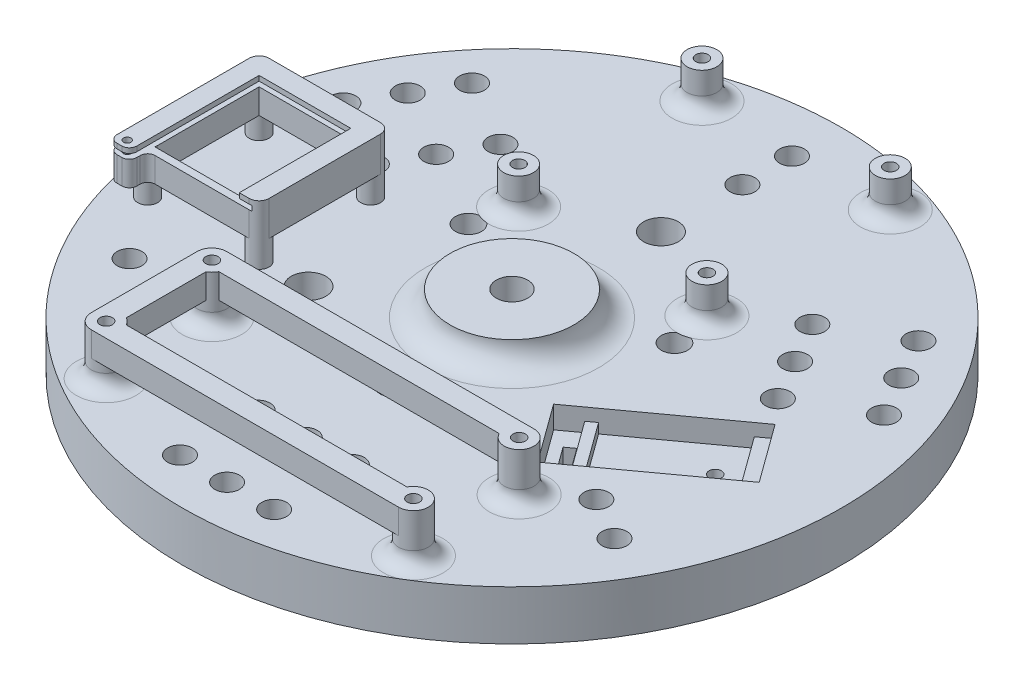
from build123d import *

# Parameters (mm, degrees)
BOSS_EXTRUDE7_DEPTH  = 10
SKETCH1_23_R         = 65.000000017
SKETCH1_23_R_2       = 4.125
BOSS_EXTRUDE8_DEPTH  = 10
CUT_EXTRUDE1_START   = 65
SKETCH16_R           = 2.5
CUT_EXTRUDE1_DEPTH   = 20
BOSS_EXTRUDE9_START  = -0.5
SKETCH17_R           = 12.5
SKETCH17_R_2         = 3.175
BOSS_EXTRUDE9_DEPTH  = 5.5
FILLET1_R            = 5
SKETCH18_R           = 2.5
SKETCH18_R_2         = 3.5
CUT_EXTRUDE2_DEPTH   = 10
SKETCH19_R           = 3
SKETCH19_R_2         = 1.25
BOSS_EXTRUDE10_DEPTH = 7.5
FILLET2_R            = 3
SKETCH20_R           = 2.625
CUT_EXTRUDE11_DEPTH  = 25
CUT_EXTRUDE12_DEPTH  = 9.8
SKETCH19_10_R        = 1.25
CUT_EXTRUDE13_DEPTH  = 4.5
CUT_EXTRUDE14_DEPTH  = 2.5
SKETCH19_12_R        = 1.25
CUT_EXTRUDE15_DEPTH  = 12.5
BOSS_EXTRUDE22_START = 5
SKETCH19_13_R        = 1.25
BOSS_EXTRUDE22_DEPTH = 5
SKETCH19_14_R        = 2
BOSS_EXTRUDE23_DEPTH = 7.5
BOSS_EXTRUDE24_START = 5
BOSS_EXTRUDE24_DEPTH = 5
BOSS_EXTRUDE25_START = 10
BOSS_EXTRUDE25_DEPTH = 1
BOSS_EXTRUDE26_START = 11
BOSS_EXTRUDE26_DEPTH = 1
BOSS_EXTRUDE27_START = -1
SKETCH23_R           = 0.75
BOSS_EXTRUDE27_DEPTH = 1
BOSS_EXTRUDE28_START = -7
SKETCH23_3_R         = 0.75
BOSS_EXTRUDE28_DEPTH = 5
FILLET15_R           = 1.5
FILLET16_R           = 1.5


with BuildPart() as part:
    # Sketch1 → Boss-Extrude7 (new body)
    with BuildSketch(Plane(origin=(0, 0, 0), x_dir=(1, 0, 0), z_dir=(0, 1, 0))):
        with BuildLine():
            ThreePointArc((-10.099280768, -64.210626285), (-56.291651246, -32.5), (-60.65767394, 23.359079438))
            Line((-60.65767394, 23.359079438), (-64.257390064, 17.124188218))
            ThreePointArc((-64.257390064, 17.124188218), (-57.590689352, -33.25), (-17.298713017, -64.210626285))
            Line((-17.298713017, -64.210626285), (-10.099280768, -64.210626285))
        make_face()
        with BuildLine():
            Line((-64.257390064, 17.124188218), (-60.65767394, 23.359079438))
            ThreePointArc((-60.65767394, 23.359079438), (-60.639599413, 23.405960416), (-60.621488653, 23.452827409))
            Line((-60.621488653, 23.452827409), (-61.93581913, 24.211656463))
            ThreePointArc((-61.93581913, 24.211656463), (-63.196040724, 20.700493636), (-64.257390064, 17.124188218))
        make_face()
        with BuildLine():
            ThreePointArc((-60.621488653, 23.452827409), (-59.667920988, 25.782536821), (-58.624860802, 28.073576473))
            ThreePointArc((-58.624860802, 28.073576473), (-54.991019149, 34.65527107), (-50.621488653, 40.773335485))
            Line((-50.621488653, 40.773335485), (-51.93581913, 41.532164539))
            ThreePointArc((-51.93581913, 41.532164539), (-57.590689352, 33.25), (-61.93581913, 24.211656463))
            Line((-61.93581913, 24.211656463), (-60.621488653, 23.452827409))
        make_face()
        with BuildLine():
            ThreePointArc((-50.621488653, 40.773335485), (-50.589956027, 40.812453359), (-50.558393172, 40.851546848))
            Line((-50.558393172, 40.851546848), (-46.958677048, 47.086438068))
            ThreePointArc((-46.958677048, 47.086438068), (-49.525173722, 44.379129868), (-51.93581913, 41.532164539))
            Line((-51.93581913, 41.532164539), (-50.621488653, 40.773335485))
        make_face()
        with BuildLine():
            Line((-46.958677048, 47.086438068), (-50.558393172, 40.851546848))
            ThreePointArc((-50.558393172, 40.851546848), (0, 65), (50.558393172, 40.851546848))
            Line((50.558393172, 40.851546848), (46.958677048, 47.086438068))
            ThreePointArc((46.958677048, 47.086438068), (0, 66.5), (-46.958677048, 47.086438068))
        make_face()
        with BuildLine():
            Line((46.958677048, 47.086438068), (50.558393172, 40.851546848))
            ThreePointArc((50.558393172, 40.851546848), (50.589956027, 40.812453359), (50.621488653, 40.773335485))
            Line((50.621488653, 40.773335485), (51.93581913, 41.532164539))
            ThreePointArc((51.93581913, 41.532164539), (49.525173722, 44.379129868), (46.958677048, 47.086438068))
        make_face()
        with BuildLine():
            Line((51.93581913, 41.532164539), (50.621488653, 40.773335485))
            ThreePointArc((50.621488653, 40.773335485), (52.162292355, 38.782666956), (53.624860802, 36.733830511))
            ThreePointArc((53.624860802, 36.733830511), (57.507854696, 30.295984028), (60.621488653, 23.452827409))
            Line((60.621488653, 23.452827409), (61.93581913, 24.211656463))
            ThreePointArc((61.93581913, 24.211656463), (57.590689352, 33.25), (51.93581913, 41.532164539))
        make_face()
        with BuildLine():
            ThreePointArc((64.257390064, 17.124188218), (63.196040724, 20.700493636), (61.93581913, 24.211656463))
            Line((61.93581913, 24.211656463), (60.621488653, 23.452827409))
            ThreePointArc((60.621488653, 23.452827409), (60.639599413, 23.405960416), (60.65767394, 23.359079438))
            Line((60.65767394, 23.359079438), (64.257390064, 17.124188218))
        make_face()
        with BuildLine():
            ThreePointArc((66.5, 0), (65.936963986, 8.635205867), (64.257390064, 17.124188218))
            Line((64.257390064, 17.124188218), (60.65767394, 23.359079438))
            ThreePointArc((60.65767394, 23.359079438), (63.90519856, 11.879629495), (65, 0))
            ThreePointArc((65, 0), (49.40371064, -42.240660211), (10.099280768, -64.210626285))
            Line((10.099280768, -64.210626285), (17.298713017, -64.210626285))
            ThreePointArc((17.298713017, -64.210626285), (52.785482927, -40.44678964), (66.5, 0))
        make_face()
        with BuildLine():
            ThreePointArc((-10, -64.226162893), (-10.049643386, -64.218413775), (-10.099280768, -64.210626285))
            Line((-10.099280768, -64.210626285), (-17.298713017, -64.210626285))
            ThreePointArc((-17.298713017, -64.210626285), (-13.670867002, -65.079623504), (-10, -65.743821002))
            Line((-10, -65.743821002), (-10, -64.226162893))
        make_face()
        with BuildLine():
            ThreePointArc((5, -64.807406984), (-2.516835548, -64.951255098), (-10, -64.226162893))
            Line((-10, -64.226162893), (-10, -65.743821002))
            ThreePointArc((-10, -65.743821002), (0, -66.5), (10, -65.743821002))
            Line((10, -65.743821002), (10, -64.226162893))
            ThreePointArc((10, -64.226162893), (7.505628633, -64.565203777), (5, -64.807406984))
        make_face()
        with BuildLine():
            Line((10, -64.226162893), (10, -65.743821002))
            ThreePointArc((10, -65.743821002), (13.670867002, -65.079623504), (17.298713017, -64.210626285))
            Line((17.298713017, -64.210626285), (10.099280768, -64.210626285))
            ThreePointArc((10.099280768, -64.210626285), (10.049643386, -64.218413775), (10, -64.226162893))
        make_face()
    extrude(amount=BOSS_EXTRUDE7_DEPTH)

    # Sketch1<23> → Boss-Extrude8 (add)
    with BuildSketch(Plane(origin=(0, 0, 0), x_dir=(1, 0, 0), z_dir=(0, 1, 0))):
        with Locations((-3e-09, 1.7e-08)):
            Circle(SKETCH1_23_R)
        with Locations(Location((0, 0, 0), (0, 0, 270))):
            Circle(SKETCH1_23_R_2, mode=Mode.SUBTRACT)
    extrude(amount=BOSS_EXTRUDE8_DEPTH)

    # Sketch16 → Cut-Extrude1 (cut)
    with BuildSketch(Plane.XZ.offset(-75).offset(CUT_EXTRUDE1_START)):
        with Locations(Location((36.217182386, -20.91, 0), (0, 0, 90))):
            Circle(SKETCH16_R)
        with Locations(Location((49.796460718, -28.75, 0), (0, 0, 90))):
            Circle(SKETCH16_R)
        with Locations(Location((-40.967182386, -12.682758664, 0), (0, 0, 90))):
            Circle(SKETCH16_R)
        with Locations(Location((-36.217182386, -20.91, 0), (0, 0, 90))):
            Circle(SKETCH16_R)
        with Locations(Location((-49.796460718, -28.75, 0), (0, 0, 90))):
            Circle(SKETCH16_R)
        with Locations(Location((0, 41.82, 0), (0, 0, 90))):
            Circle(SKETCH16_R)
        with Locations(Location((0, 57.5, 0), (0, 0, 90))):
            Circle(SKETCH16_R)
        with Locations(Location((-31.467182386, -29.137241336, 0), (0, 0, 90))):
            Circle(SKETCH16_R)
        with Locations(Location((-45.046460718, -36.977241336, 0), (0, 0, 90))):
            Circle(SKETCH16_R)
        with Locations(Location((-54.546460718, -20.522758664, 0), (0, 0, 90))):
            Circle(SKETCH16_R)
        with Locations(Location((9.5, 41.82, 0), (0, 0, 90))):
            Circle(SKETCH16_R)
        with Locations(Location((-9.5, 41.82, 0), (0, 0, 90))):
            Circle(SKETCH16_R)
        with Locations(Location((-9.5, 57.5, 0), (0, 0, 90))):
            Circle(SKETCH16_R)
        with Locations(Location((9.5, 57.5, 0), (0, 0, 90))):
            Circle(SKETCH16_R)
        with Locations(Location((31.467182386, -29.137241336, 0), (0, 0, 90))):
            Circle(SKETCH16_R)
        with Locations(Location((40.967182386, -12.682758664, 0), (0, 0, 90))):
            Circle(SKETCH16_R)
        with Locations(Location((54.546460718, -20.522758664, 0), (0, 0, 90))):
            Circle(SKETCH16_R)
        with Locations(Location((45.046460718, -36.977241336, 0), (0, 0, 90))):
            Circle(SKETCH16_R)
    extrude(amount=CUT_EXTRUDE1_DEPTH, mode=Mode.SUBTRACT)

    # Sketch17 → Boss-Extrude9 (add)
    with BuildSketch(Plane(origin=(0, 10, 0), x_dir=(1, 0, 0), z_dir=(0, 1, 0)).offset(BOSS_EXTRUDE9_START)):
        with Locations(Location((0, 0, 0), (0, 0, 270))):
            Circle(SKETCH17_R)
        with Locations(Location((0, 0, 0), (0, 0, 270))):
            Circle(SKETCH17_R_2, mode=Mode.SUBTRACT)
    extrude(amount=BOSS_EXTRUDE9_DEPTH)

    # Fillet1
    fillet1_edges = [part.edges().sort_by_distance(p)[0] for p in [
        (0, 10, -12.5),
    ]]
    fillet(fillet1_edges, radius=FILLET1_R - 0.0001)  # a hair under: the kernel refuses the full size

    # Sketch18 → Cut-Extrude2 (cut)
    with BuildSketch(Plane(origin=(0, 10, 0), x_dir=(1, 0, 0), z_dir=(0, 1, 0))):
        with Locations(Location((0, 56.5, 0), (0, 0, 270))):
            Circle(SKETCH18_R)
        with Locations(Location((0, 46.5, 0), (0, 0, 270))):
            Circle(SKETCH18_R)
        with Locations(Location((40.270181276, -23.25, 0), (0, 0, 270))):
            Circle(SKETCH18_R)
        with Locations(Location((48.930435314, -28.25, 0), (0, 0, 270))):
            Circle(SKETCH18_R)
        with Locations(Location((-40.270181276, -23.25, 0), (0, 0, 270))):
            Circle(SKETCH18_R)
        with Locations(Location((-48.930435314, -28.25, 0), (0, 0, 270))):
            Circle(SKETCH18_R)
        with Locations(Location((-26.035163591, -15.031408708, 0), (0, 0, 270))):
            Circle(SKETCH18_R_2)
        with Locations(Location((0, 30.062817415, 0), (0, 0, 270))):
            Circle(SKETCH18_R_2)
    extrude(amount=-CUT_EXTRUDE2_DEPTH, mode=Mode.SUBTRACT)

    # Sketch19 → Boss-Extrude10 (add)
    # profile 1 of 8: a face of its own
    with BuildSketch(Plane(origin=(0, 10, 0), x_dir=(1, 0, 0), z_dir=(0, 1, 0))):
        with Locations(Location((31.651031793, -30.207147099, 0), (0, 0, 270))):
            Circle(SKETCH19_R)
        with Locations(Location((31.651031793, -30.207147099, 0), (0, 0, 270))):
            Circle(SKETCH19_R_2, mode=Mode.SUBTRACT)
    # profile 2 of 8: a face of its own
    with BuildSketch(Plane(origin=(0, 10, 0), x_dir=(1, 0, 0), z_dir=(0, 1, 0))):
        with Locations(Location((31.651031793, -51.547147099, 0), (0, 0, 270))):
            Circle(SKETCH19_R)
        with Locations(Location((31.651031793, -51.547147099, 0), (0, 0, 270))):
            Circle(SKETCH19_R_2, mode=Mode.SUBTRACT)
    # profile 3 of 8: a face of its own
    with BuildSketch(Plane(origin=(0, 10, 0), x_dir=(1, 0, 0), z_dir=(0, 1, 0))):
        with Locations(Location((-30.348968207, -51.547147099, 0), (0, 0, 270))):
            Circle(SKETCH19_R)
        with Locations(Location((-30.348968207, -51.547147099, 0), (0, 0, 270))):
            Circle(SKETCH19_R_2, mode=Mode.SUBTRACT)
    # profile 4 of 8: a face of its own
    with BuildSketch(Plane(origin=(0, 10, 0), x_dir=(1, 0, 0), z_dir=(0, 1, 0))):
        with Locations(Location((-30.348968207, -30.207147099, 0), (0, 0, 270))):
            Circle(SKETCH19_R)
        with Locations(Location((-30.348968207, -30.207147099, 0), (0, 0, 270))):
            Circle(SKETCH19_R_2, mode=Mode.SUBTRACT)
    # profile 5 of 8: a face of its own
    with BuildSketch(Plane(origin=(0, 10, 0), x_dir=(1, 0, 0), z_dir=(0, 1, 0))):
        with Locations(Location((19.296192499, 57.037679725, 0), (0, 0, 270))):
            Circle(SKETCH19_R)
        with Locations(Location((19.296192499, 57.037679725, 0), (0, 0, 270))):
            Circle(SKETCH19_R_2, mode=Mode.SUBTRACT)
    # profile 6 of 8: a face of its own
    with BuildSketch(Plane(origin=(0, 10, 0), x_dir=(1, 0, 0), z_dir=(0, 1, 0))):
        with Locations(Location((19.296192499, 20.037679725, 0), (0, 0, 270))):
            Circle(SKETCH19_R)
        with Locations(Location((19.296192499, 20.037679725, 0), (0, 0, 270))):
            Circle(SKETCH19_R_2, mode=Mode.SUBTRACT)
    # profile 7 of 8: a face of its own
    with BuildSketch(Plane(origin=(0, 10, 0), x_dir=(1, 0, 0), z_dir=(0, 1, 0))):
        with Locations(Location((-18.703807501, 20.037679725, 0), (0, 0, 270))):
            Circle(SKETCH19_R)
        with Locations(Location((-18.703807501, 20.037679725, 0), (0, 0, 270))):
            Circle(SKETCH19_R_2, mode=Mode.SUBTRACT)
    # profile 8 of 8: a face of its own
    with BuildSketch(Plane(origin=(0, 10, 0), x_dir=(1, 0, 0), z_dir=(0, 1, 0))):
        with Locations(Location((-18.703807501, 57.037679725, 0), (0, 0, 270))):
            Circle(SKETCH19_R)
        with Locations(Location((-18.703807501, 57.037679725, 0), (0, 0, 270))):
            Circle(SKETCH19_R_2, mode=Mode.SUBTRACT)
    extrude(amount=BOSS_EXTRUDE10_DEPTH)

    # Fillet2
    fillet2_edges = [part.edges().sort_by_distance(p)[0] for p in [
        (-18.703807501, 10, -60.037679725),
        (-18.703807501, 10, -23.037679725),
        (19.296192499, 10, -23.037679725),
        (19.296192499, 10, -60.037679725),
        (-30.348968207, 10, 27.207147099),
        (-30.348968207, 10, 48.547147099),
        (31.651031793, 10, 48.547147099),
        (31.651031793, 10, 27.207147099),
    ]]
    fillet(fillet2_edges, radius=FILLET2_R)

    # Sketch20 → Cut-Extrude11 (cut)
    with BuildSketch(Plane(origin=(0, 10, 0), x_dir=(1, 0, 0), z_dir=(0, 1, 0))):
        with Locations(Location((-20.784609691, 12, 0), (0, 0, 270))):
            Circle(SKETCH20_R)
        with Locations(Location((0, -24, 0), (0, 0, 270))):
            Circle(SKETCH20_R)
        with Locations(Location((20.784609691, 12, 0), (0, 0, 270))):
            Circle(SKETCH20_R)
    extrude(amount=-CUT_EXTRUDE11_DEPTH, mode=Mode.SUBTRACT)

    # Sketch19<8> → Cut-Extrude12 (cut)
    with BuildSketch(Plane(origin=(0, 10, 0), x_dir=(1, 0, 0), z_dir=(0, 1, 0))):
        Polygon((28.700081178, -17.041519979), (27.082047189, -18.217090484), (23.261443049, -12.958480021), (24.879477038, -11.782909516), align=None)
    extrude(amount=-CUT_EXTRUDE12_DEPTH, mode=Mode.SUBTRACT)

    # Sketch19<10> → Cut-Extrude13 (cut)
    # profile 1 of 2: a face of its own
    with BuildSketch(Plane(origin=(0, 10, 0), x_dir=(1, 0, 0), z_dir=(0, 1, 0))):
        Polygon((33.073764673, -18.808124826), (51.276647046, -5.58295665), (42.753760888, 6.147789769), (24.550878515, -7.077378408), align=None)
        with Locations(Location((43.374627493, -2.362617076, 0), (0, 0, 270))):
            Circle(SKETCH19_10_R, mode=Mode.SUBTRACT)
    # profile 2 of 2: a face of its own
    with BuildSketch(Plane(origin=(0, 10, 0), x_dir=(1, 0, 0), z_dir=(0, 1, 0))):
        Polygon((27.81515421, -22.628728966), (31.455730684, -19.983695331), (22.932844526, -8.252948912), (19.292268051, -10.897982548), align=None)
        Polygon((28.700081178, -17.041519979), (27.082047189, -18.217090484), (23.261443049, -12.958480021), (24.879477038, -11.782909516), align=None, mode=Mode.SUBTRACT)
    extrude(amount=-CUT_EXTRUDE13_DEPTH, mode=Mode.SUBTRACT)

    # Sketch19<11> → Cut-Extrude14 (cut)
    with BuildSketch(Plane(origin=(0, 10, 0), x_dir=(1, 0, 0), z_dir=(0, 1, 0))):
        Polygon((51.276647046, -5.58295665), (53.70369803, -3.819600893), (45.180811871, 7.911145526), (42.753760888, 6.147789769), align=None)
        Polygon((31.455730684, -19.983695331), (33.073764673, -18.808124826), (24.550878515, -7.077378408), (22.932844526, -8.252948912), align=None)
    extrude(amount=-CUT_EXTRUDE14_DEPTH, mode=Mode.SUBTRACT)

    # Sketch19<12> → Cut-Extrude15 (cut)
    with BuildSketch(Plane(origin=(0, 10, 0), x_dir=(1, 0, 0), z_dir=(0, 1, 0))):
        with Locations(Location((43.374627493, -2.362617076, 0), (0, 0, 270))):
            Circle(SKETCH19_12_R)
    extrude(amount=-CUT_EXTRUDE15_DEPTH, mode=Mode.SUBTRACT)

    # Sketch19<13> → Boss-Extrude22 (add)
    with BuildSketch(Plane(origin=(0, 10, 0), x_dir=(1, 0, 0), z_dir=(0, 1, 0)).offset(BOSS_EXTRUDE22_START)):
        with BuildLine():
            ThreePointArc((31.651031793, -54.547147099), (34.213419954, -49.986965407), (28.985837728, -50.169925042))
            Line((28.985837728, -50.169925042), (-27.683774142, -50.169925042))
            ThreePointArc((-27.683774142, -50.169925042), (-28.204760048, -49.448964226), (-28.914248251, -48.912459519))
            Line((-28.914248251, -48.912459519), (-28.914248251, -32.84183468))
            ThreePointArc((-28.914248251, -32.84183468), (-28.180650254, -32.280404742), (-27.652649658, -31.522390911))
            Line((-27.652649658, -31.522390911), (28.954713245, -31.522390911))
            ThreePointArc((28.954713245, -31.522390911), (34.195214514, -31.796843386), (31.651031793, -27.207147099))
            Line((31.651031793, -27.207147099), (-30.348968207, -27.207147099))
            ThreePointArc((-30.348968207, -27.207147099), (-32.47028855, -28.085826756), (-33.348968207, -30.207147099))
            Line((-33.348968207, -30.207147099), (-33.348968207, -51.547147099))
            ThreePointArc((-33.348968207, -51.547147099), (-32.47028855, -53.668467443), (-30.348968207, -54.547147099))
            Line((-30.348968207, -54.547147099), (31.651031793, -54.547147099))
        make_face()
        with Locations(Location((-30.348968207, -51.547147099, 0), (0, 0, 270))):
            Circle(SKETCH19_13_R, mode=Mode.SUBTRACT)
        with Locations(Location((31.651031793, -51.547147099, 0), (0, 0, 270))):
            Circle(SKETCH19_13_R, mode=Mode.SUBTRACT)
        with Locations(Location((-30.348968207, -30.207147099, 0), (0, 0, 270))):
            Circle(SKETCH19_13_R, mode=Mode.SUBTRACT)
        with Locations(Location((31.651031793, -30.207147099, 0), (0, 0, 270))):
            Circle(SKETCH19_13_R, mode=Mode.SUBTRACT)
    extrude(amount=BOSS_EXTRUDE22_DEPTH)

    # Sketch19<14> → Boss-Extrude23 (add)
    with BuildSketch(Plane(origin=(0, 10, 0), x_dir=(1, 0, 0), z_dir=(0, 1, 0))):
        with Locations(Location((-57.87101355, 6.838674431, 0), (0, 0, 270))):
            Circle(SKETCH19_14_R)
        with Locations(Location((-57.87101355, -15.661325569, 0), (0, 0, 270))):
            Circle(SKETCH19_14_R)
        with Locations(Location((-35.37101355, -15.661325569, 0), (0, 0, 270))):
            Circle(SKETCH19_14_R)
        with Locations(Location((-35.37101355, 6.838674431, 0), (0, 0, 270))):
            Circle(SKETCH19_14_R)
    extrude(amount=BOSS_EXTRUDE23_DEPTH)

    # Sketch19<15> → Boss-Extrude24 (add)
    with BuildSketch(Plane(origin=(0, 10, 0), x_dir=(1, 0, 0), z_dir=(0, 1, 0)).offset(BOSS_EXTRUDE24_START)):
        with BuildLine():
            Line((-57.87101355, -17.661325569), (-35.37101355, -17.661325569))
            ThreePointArc((-35.37101355, -17.661325569), (-33.956799988, -17.075539131), (-33.37101355, -15.661325569))
            Line((-33.37101355, -15.661325569), (-33.37101355, 6.838674431))
            ThreePointArc((-33.37101355, 6.838674431), (-33.956799988, 8.252887993), (-35.37101355, 8.838674431))
            Line((-35.37101355, 8.838674431), (-57.87101355, 8.838674431))
            ThreePointArc((-57.87101355, 8.838674431), (-59.285227112, 8.252887993), (-59.87101355, 6.838674431))
            Line((-59.87101355, 6.838674431), (-59.87101355, -15.661325569))
            ThreePointArc((-59.87101355, -15.661325569), (-59.285227112, -17.075539131), (-57.87101355, -17.661325569))
        make_face()
        with BuildLine():
            ThreePointArc((-37.37101355, -15.661325569), (-37.355072943, -15.913334154), (-37.307505223, -16.161325569))
            Line((-37.307505223, -16.161325569), (-55.934521877, -16.161325569))
            ThreePointArc((-55.934521877, -16.161325569), (-55.886954157, -15.913334154), (-55.87101355, -15.661325569))
            Line((-55.87101355, -15.661325569), (-55.87101355, 4.838674431))
            Line((-55.87101355, 4.838674431), (-37.37101355, 4.838674431))
            Line((-37.37101355, 4.838674431), (-37.37101355, -15.661325569))
        make_face(mode=Mode.SUBTRACT)
    extrude(amount=BOSS_EXTRUDE24_DEPTH)

    # Sketch19<16> → Boss-Extrude25 (add)
    with BuildSketch(Plane(origin=(0, 10, 0), x_dir=(1, 0, 0), z_dir=(0, 1, 0)).offset(BOSS_EXTRUDE25_START)):
        with BuildLine():
            Line((-59.87101355, 6.838674431), (-59.87101355, -15.661325569))
            ThreePointArc((-59.87101355, -15.661325569), (-59.45215238, -16.88607044), (-58.37101355, -17.597817242))
            Line((-58.37101355, -17.597817242), (-58.37101355, 7.338674431))
            Line((-58.37101355, 7.338674431), (-34.87101355, 7.338674431))
            Line((-34.87101355, 7.338674431), (-34.87101355, -17.597817242))
            ThreePointArc((-34.87101355, -17.597817242), (-33.78987472, -16.88607044), (-33.37101355, -15.661325569))
            Line((-33.37101355, -15.661325569), (-33.37101355, 6.838674431))
            ThreePointArc((-33.37101355, 6.838674431), (-33.956799988, 8.252887993), (-35.37101355, 8.838674431))
            Line((-35.37101355, 8.838674431), (-57.87101355, 8.838674431))
            ThreePointArc((-57.87101355, 8.838674431), (-59.285227112, 8.252887993), (-59.87101355, 6.838674431))
        make_face()
    extrude(amount=BOSS_EXTRUDE25_DEPTH)

    # Sketch19<17> → Boss-Extrude26 (add)
    with BuildSketch(Plane(origin=(0, 10, 0), x_dir=(1, 0, 0), z_dir=(0, 1, 0)).offset(BOSS_EXTRUDE26_START)):
        with BuildLine():
            ThreePointArc((-57.87101355, 8.838674431), (-59.285227112, 8.252887993), (-59.87101355, 6.838674431))
            Line((-59.87101355, 6.838674431), (-59.87101355, -15.661325569))
            ThreePointArc((-59.87101355, -15.661325569), (-59.285227112, -17.075539131), (-57.87101355, -17.661325569))
            Line((-57.87101355, -17.661325569), (-55.87101355, -17.661325569))
            Line((-55.87101355, -17.661325569), (-55.87101355, 4.838674431))
            Line((-55.87101355, 4.838674431), (-37.37101355, 4.838674431))
            Line((-37.37101355, 4.838674431), (-37.37101355, -17.661325569))
            Line((-37.37101355, -17.661325569), (-35.37101355, -17.661325569))
            ThreePointArc((-35.37101355, -17.661325569), (-33.956799988, -17.075539131), (-33.37101355, -15.661325569))
            Line((-33.37101355, -15.661325569), (-33.37101355, 6.838674431))
            ThreePointArc((-33.37101355, 6.838674431), (-33.956799988, 8.252887993), (-35.37101355, 8.838674431))
            Line((-35.37101355, 8.838674431), (-57.87101355, 8.838674431))
        make_face()
    extrude(amount=BOSS_EXTRUDE26_DEPTH)

    # Sketch23 → Boss-Extrude27 (add)
    with BuildSketch(Plane(origin=(0, 22, 0), x_dir=(1, 0, 0), z_dir=(0, 1, 0)).offset(BOSS_EXTRUDE27_START)):
        with BuildLine():
            ThreePointArc((-57.87101355, -17.661325569), (-59.285227112, -17.075539131), (-59.87101355, -15.661325569))
            Line((-59.87101355, -15.661325569), (-59.87101355, -21.346892637))
            Line((-59.87101355, -21.346892637), (-55.87101355, -21.346892637))
            Line((-55.87101355, -21.346892637), (-55.87101355, -17.661325569))
            Line((-55.87101355, -17.661325569), (-57.87101355, -17.661325569))
        make_face()
        with Locations(Location((-57.87101355, -19.78357158, 0), (0, 0, 270))):
            Circle(SKETCH23_R, mode=Mode.SUBTRACT)
    extrude(amount=BOSS_EXTRUDE27_DEPTH)

    # Sketch23<3> → Boss-Extrude28 (add)
    with BuildSketch(Plane(origin=(0, 22, 0), x_dir=(1, 0, 0), z_dir=(0, 1, 0)).offset(BOSS_EXTRUDE28_START)):
        with BuildLine():
            ThreePointArc((-57.87101355, -17.661325569), (-59.285227112, -17.075539131), (-59.87101355, -15.661325569))
            Line((-59.87101355, -15.661325569), (-59.87101355, -21.346892637))
            Line((-59.87101355, -21.346892637), (-55.87101355, -21.346892637))
            Line((-55.87101355, -21.346892637), (-55.87101355, -17.661325569))
            Line((-55.87101355, -17.661325569), (-57.87101355, -17.661325569))
        make_face()
        with Locations(Location((-57.87101355, -19.78357158, 0), (0, 0, 270))):
            Circle(SKETCH23_3_R, mode=Mode.SUBTRACT)
    extrude(amount=BOSS_EXTRUDE28_DEPTH)

    # Fillet15
    fillet15_edges = [part.edges().sort_by_distance(p)[0] for p in [
        (-55.87101355, 21.5, 21.346892637),
        (-59.87101355, 21.5, 21.346892637),
        (-55.87101355, 17.5, 21.346892637),
        (-59.87101355, 17.5, 21.346892637),
    ]]
    fillet(fillet15_edges, radius=FILLET15_R)

    # Fillet16
    fillet16_edges = [part.edges().sort_by_distance(p)[0] for p in [
        (-55.87101355, 17.5, 17.661325569),
    ]]
    fillet(fillet16_edges, radius=FILLET16_R)


solid = part.part
